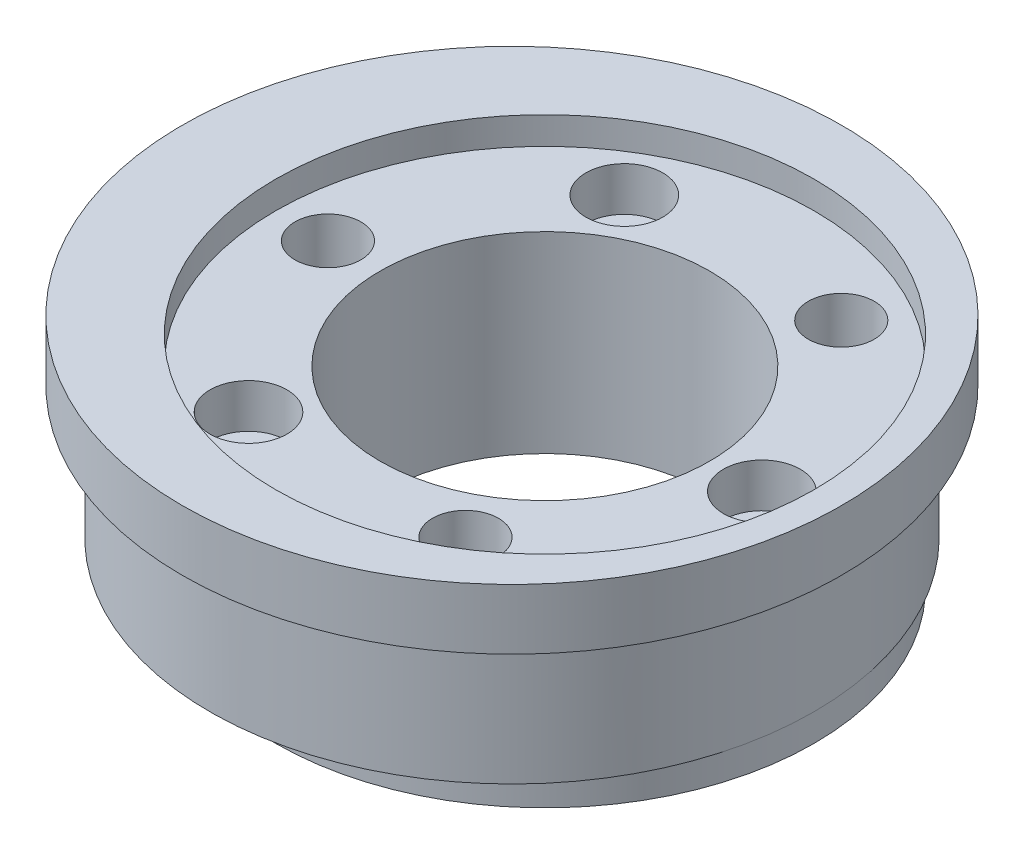
from build123d import *
from build123d.topology import SkipClean

# Parameters (mm, degrees)
SKETCH1_R            = 27.5
BOSS_EXTRUDE1_DEPTH  = 15
BOSS_EXTRUDE3_DEPTH  = 2.5
FILLET2_R            = 1.5
SKETCH4_R            = 3
CUT_EXTRUDE1_DEPTH   = 5
SKETCH5_R            = 15
CUT_EXTRUDE2_DEPTH   = 15
SKETCH7_R            = 24.5
SKETCH7_R_2          = 15
BOSS_EXTRUDE6_DEPTH  = 2.5
SKETCH8_R            = 2
CUT_EXTRUDE3_DEPTH   = 17.5
SKETCH9_R            = 3.5
SKETCH9_R_2          = 2
CUT_EXTRUDE4_DEPTH   = 4
SKETCH10_R           = 2
CUT_EXTRUDE5_DEPTH   = 2.5
SKETCH14_R           = 30
SKETCH14_R_2         = 24.5
BOSS_EXTRUDE14_DEPTH = 5.5


with BuildPart() as part:
    # Sketch1 → Boss-Extrude1 (new body)
    with BuildSketch(Plane(origin=(0, 0, 0), x_dir=(1, 0, 0), z_dir=(0, 1, 0))):
        Circle(SKETCH1_R)
    extrude(amount=BOSS_EXTRUDE1_DEPTH)

    # Sketch3 → Boss-Extrude3 (add)
    with BuildSketch(Plane(origin=(0, 15, 0), x_dir=(1, 0, 0), z_dir=(0, 1, 0))):
        with BuildLine():
            ThreePointArc((0, -24.315632832), (-21.5, 0), (0, 24.315632832))
            Line((0, 24.315632832), (0, 27.5))
            ThreePointArc((0, 27.5), (-27.5, 0), (0, -27.5))
            Line((0, -27.5), (0, -24.315632832))
        make_face()
    extrude(amount=BOSS_EXTRUDE3_DEPTH)

    # Fillet2
    fillet2_edges = [part.edges().sort_by_distance(p)[0] for p in [
        (0, 16.25, -27.5),
        (0, 16.25, -24.315632832),
        (0, 16.25, 24.315632832),
        (0, 16.25, 27.5),
    ]]
    fillet(fillet2_edges, radius=FILLET2_R)

    # Sketch4 → Cut-Extrude1 (cut)
    with BuildSketch(Plane(origin=(0, 15, 0), x_dir=(1, 0, 0), z_dir=(0, 1, 0))):
        with Locations((-16.75, 0)):
            Circle(SKETCH4_R)
        with Locations((12.875, 17.104001725)):
            Circle(SKETCH4_R)
        with Locations((12.875, -17.104001725)):
            Circle(SKETCH4_R)
    extrude(amount=-CUT_EXTRUDE1_DEPTH, mode=Mode.SUBTRACT)

    # Sketch5 → Cut-Extrude2 (cut)
    with BuildSketch(Plane(origin=(0, 15, 0), x_dir=(1, 0, 0), z_dir=(0, 1, 0))):
        with Locations((3, 0)):
            Circle(SKETCH5_R)
    extrude(amount=-CUT_EXTRUDE2_DEPTH, mode=Mode.SUBTRACT)

    # Sketch7 → Boss-Extrude6 (add)
    with BuildSketch(Plane.XZ):
        with Locations((3, 0)):
            Circle(SKETCH7_R)
        with Locations((3, 0)):
            Circle(SKETCH7_R_2, mode=Mode.SUBTRACT)
    extrude(amount=BOSS_EXTRUDE6_DEPTH)

    # Sketch8 → Cut-Extrude3 (cut)
    with BuildSketch(Plane(origin=(0, 15, 0), x_dir=(1, 0, 0), z_dir=(0, 1, 0))):
        with Locations((-6.875, 17.104001725)):
            Circle(SKETCH8_R)
        with Locations((22.75, 0)):
            Circle(SKETCH8_R)
        with Locations((-6.875, -17.104001725)):
            Circle(SKETCH8_R)
    extrude(amount=-CUT_EXTRUDE3_DEPTH, mode=Mode.SUBTRACT)

    # Sketch9 → Cut-Extrude4 (cut)
    # profile 1 of 3: a face of its own
    with BuildSketch(Plane(origin=(0, 15, 0), x_dir=(1, 0, 0), z_dir=(0, 1, 0))):
        with Locations((-6.875, 17.104001725)):
            Circle(SKETCH9_R)
        with Locations((-6.875, 17.104001725)):
            Circle(SKETCH9_R_2, mode=Mode.SUBTRACT)
    # profile 2 of 3: a face of its own
    with BuildSketch(Plane(origin=(0, 15, 0), x_dir=(1, 0, 0), z_dir=(0, 1, 0))):
        with Locations((22.75, 0)):
            Circle(SKETCH9_R)
        with Locations((22.75, 0)):
            Circle(SKETCH9_R_2, mode=Mode.SUBTRACT)
    # profile 3 of 3: a face of its own
    with BuildSketch(Plane(origin=(0, 15, 0), x_dir=(1, 0, 0), z_dir=(0, 1, 0))):
        with Locations((-6.875, -17.104001725)):
            Circle(SKETCH9_R)
        with Locations((-6.875, -17.104001725)):
            Circle(SKETCH9_R_2, mode=Mode.SUBTRACT)
    extrude(amount=-CUT_EXTRUDE4_DEPTH, mode=Mode.SUBTRACT)

    # Sketch10 → Cut-Extrude5 (cut)
    with BuildSketch(Plane(origin=(0, 10, 0), x_dir=(1, 0, 0), z_dir=(0, 1, 0))):
        with Locations((-16.75, 0)):
            Circle(SKETCH10_R)
        with Locations((12.875, 17.104001725)):
            Circle(SKETCH10_R)
        with Locations((12.875, -17.104001725)):
            Circle(SKETCH10_R)
    extrude(amount=-CUT_EXTRUDE5_DEPTH, mode=Mode.SUBTRACT)

    # Sketch14 → Boss-Extrude14 (add)
    with SkipClean():  # the faces are left unmerged after this step: merging them gives an invalid solid
        with BuildSketch(Plane(origin=(0, 17.5, 0), x_dir=(1, 0, 0), z_dir=(0, 1, 0))):
            Circle(SKETCH14_R)
            with Locations((3, 0)):
                Circle(SKETCH14_R_2, mode=Mode.SUBTRACT)
        extrude(amount=-BOSS_EXTRUDE14_DEPTH)


solid = part.part
